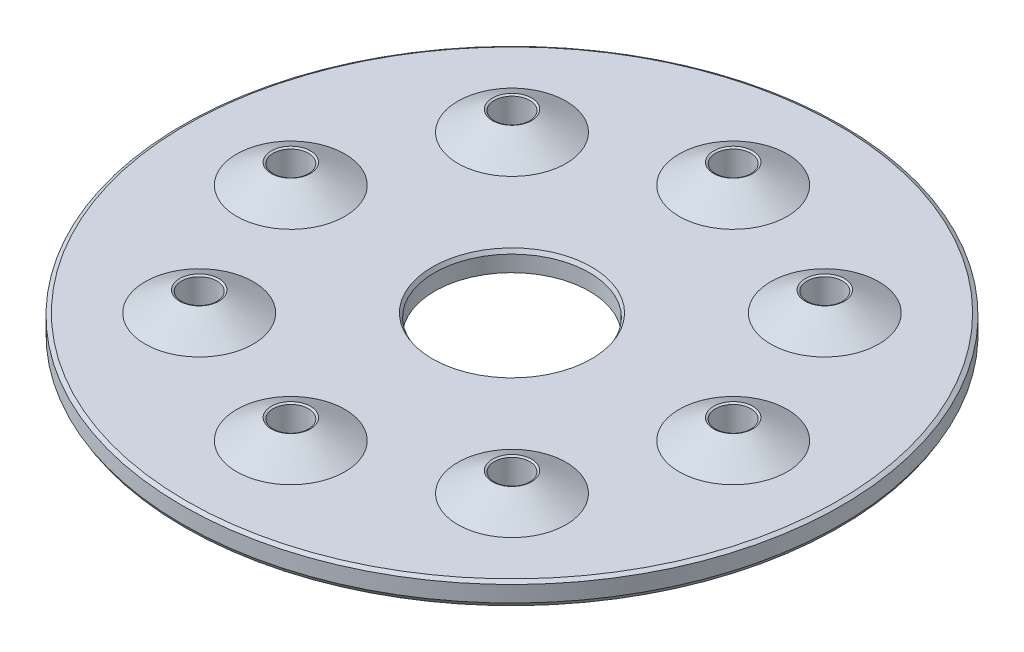
from build123d import *
from OCP.BRepFilletAPI import BRepFilletAPI_MakeChamfer

# Parameters (mm, degrees)
SKETCH1_R           = 74.5
SKETCH1_R_2         = 4
SKETCH1_R_3         = 17.5
BOSS_EXTRUDE1_DEPTH = 2.5
CHAMFER1_SIZE       = 0.5
CHAMFER1_SIZE2      = 0.866025404


# Read off the part's stored shape, not the designer's step: CirPattern1
with BuildPart() as part:
    # Sketch1 → Boss-Extrude1 (new, symmetric)
    with BuildSketch(Plane(origin=(0, 0, 0), x_dir=(1, 0, 0), z_dir=(0, 1, 0))):
        with Locations(Location((0, 0, 0), (0, 0, 270))):
            Circle(SKETCH1_R)
        with Locations(Location((0, 50, 0), (0, 0, 270))):
            Circle(SKETCH1_R_2, mode=Mode.SUBTRACT)
        with Locations(Location((35.355339059, 35.355339059, 0), (0, 0, 270))):
            Circle(SKETCH1_R_2, mode=Mode.SUBTRACT)
        with Locations(Location((50, 0, 0), (0, 0, 270))):
            Circle(SKETCH1_R_2, mode=Mode.SUBTRACT)
        with Locations(Location((35.355339059, -35.355339059, 0), (0, 0, 270))):
            Circle(SKETCH1_R_2, mode=Mode.SUBTRACT)
        with Locations(Location((0, -50, 0), (0, 0, 270))):
            Circle(SKETCH1_R_2, mode=Mode.SUBTRACT)
        with Locations(Location((-35.355339059, -35.355339059, 0), (0, 0, 270))):
            Circle(SKETCH1_R_2, mode=Mode.SUBTRACT)
        with Locations(Location((-50, 0, 0), (0, 0, 270))):
            Circle(SKETCH1_R_2, mode=Mode.SUBTRACT)
        with Locations(Location((-35.355339059, 35.355339059, 0), (0, 0, 270))):
            Circle(SKETCH1_R_2, mode=Mode.SUBTRACT)
        with Locations(Location((0, 0, 0), (0, 0, 270))):
            Circle(SKETCH1_R_3, mode=Mode.SUBTRACT)
    extrude(amount=BOSS_EXTRUDE1_DEPTH, both=True)

    # Sketch2 → Revolve1 (revolve)
    with BuildSketch(Plane(origin=(0, 0, 0), x_dir=(0, 0, -1), z_dir=(1, 0, 0)), mode=Mode.PRIVATE) as revolve1_sk:
        Polygon((-62.227241336, 2.5), (-54, 7.25), (-54, -7.25), (-62.227241336, -2.5), align=None)
    revolve(revolve1_sk.sketch.rotate(Axis((0, 2.5, 50), (0, 1, 0)), 180), axis=Axis((0, 2.5, 50), (0, 1, 0)))

    # Chamfer1: one chamfer whose edges measure the first distance from different faces: ONE call of the kernel's chamfer builder (chamfer() names one face for all edges)
    chamfer1_edges_1 = [part.edges().sort_by_distance(p)[0] for p in [
        (0, -2.5, -17.5),
    ]]
    chamfer1_side_1 = [part.faces().sort_by_distance(p)[0] for p in [
        (0, 0, -17.5),
    ]]
    chamfer1_edges_2 = [part.edges().sort_by_distance(p)[0] for p in [
        (0, 2.5, -17.5),
    ]]
    chamfer1_side_2 = [part.faces().sort_by_distance(p)[0] for p in [
        (0, 2.5, -72.392821792),
    ]]
    chamfer1_edges_3 = [part.edges().sort_by_distance(p)[0] for p in [
        (0, -2.5, -74.5),
    ]]
    chamfer1_side_3 = [part.faces().sort_by_distance(p)[0] for p in [
        (0, -2.5, -72.392821792),
    ]]
    chamfer1_edges_4 = [part.edges().sort_by_distance(p)[0] for p in [
        (0, -7.25, 54),
        (0, 7.25, 54),
    ]]
    chamfer1_edges_5 = [part.edges().sort_by_distance(p)[0] for p in [
        (0, 2.5, -74.5),
    ]]
    chamfer1_side_5 = [part.faces().sort_by_distance(p)[0] for p in [
        (0, 0, -74.5),
    ]]
    chamfer1 = BRepFilletAPI_MakeChamfer(part.part.solid().wrapped)
    for e in chamfer1_edges_1:
        chamfer1.Add(CHAMFER1_SIZE, CHAMFER1_SIZE2, e.wrapped, chamfer1_side_1[0].wrapped)  # the first distance lies on this face
    for e in chamfer1_edges_2:
        chamfer1.Add(CHAMFER1_SIZE, CHAMFER1_SIZE2, e.wrapped, chamfer1_side_2[0].wrapped)  # the first distance lies on this face
    for e in chamfer1_edges_3:
        chamfer1.Add(CHAMFER1_SIZE, CHAMFER1_SIZE2, e.wrapped, chamfer1_side_3[0].wrapped)  # the first distance lies on this face
    for e in chamfer1_edges_4:
        chamfer1.Add(CHAMFER1_SIZE, e.wrapped)
    for e in chamfer1_edges_5:
        chamfer1.Add(CHAMFER1_SIZE, CHAMFER1_SIZE2, e.wrapped, chamfer1_side_5[0].wrapped)  # the first distance lies on this face
    add(Compound.cast(chamfer1.Shape()), mode=Mode.REPLACE)

    # CirPattern1 outline → CirPattern1 (revolve)
    with BuildSketch(Plane(origin=(-35.355339059, 0, 35.355339059), x_dir=(1, 0, 0), z_dir=(0, 0, 1))):
        Polygon((4, -6.75), (4.433012702, -7), (12.227241336, -2.5), (4, -2.5), align=None)
        Polygon((4, 2.5), (12.227241336, 2.5), (4.433012702, 7), (4, 6.75), align=None)
    revolve(axis=Axis((-35.355339059, 0, 35.355339059), (0, 1, 0)))

    # CirPattern1 2 outline → CirPattern1 2 (revolve)
    with BuildSketch(Plane(origin=(-50, 0, 0), x_dir=(1, 0, 0), z_dir=(0, 0, 1))):
        Polygon((4, -6.75), (4.433012702, -7), (12.227241336, -2.5), (4, -2.5), align=None)
        Polygon((4, 2.5), (12.227241336, 2.5), (4.433012702, 7), (4, 6.75), align=None)
    revolve(axis=Axis((-50, 0, 0), (0, 1, 0)))

    # CirPattern1 3 outline → CirPattern1 3 (revolve)
    with BuildSketch(Plane(origin=(-35.355339059, 0, -35.355339059), x_dir=(1, 0, 0), z_dir=(0, 0, 1))):
        Polygon((4, -6.75), (4.433012702, -7), (12.227241336, -2.5), (4, -2.5), align=None)
        Polygon((4, 2.5), (12.227241336, 2.5), (4.433012702, 7), (4, 6.75), align=None)
    revolve(axis=Axis((-35.355339059, 0, -35.355339059), (0, 1, 0)))

    # CirPattern1 4 outline → CirPattern1 4 (revolve)
    with BuildSketch(Plane.XY.offset(-50)):
        Polygon((4, -6.75), (4.433012702, -7), (12.227241336, -2.5), (4, -2.5), align=None)
        Polygon((4, 2.5), (12.227241336, 2.5), (4.433012702, 7), (4, 6.75), align=None)
    revolve(axis=Axis((0, 0, -50), (0, 1, 0)))

    # CirPattern1 5 outline → CirPattern1 5 (revolve)
    with BuildSketch(Plane(origin=(35.355339059, 0, -35.355339059), x_dir=(1, 0, 0), z_dir=(0, 0, 1))):
        Polygon((4, -6.75), (4.433012702, -7), (12.227241336, -2.5), (4, -2.5), align=None)
        Polygon((4, 2.5), (12.227241336, 2.5), (4.433012702, 7), (4, 6.75), align=None)
    revolve(axis=Axis((35.355339059, 0, -35.355339059), (0, 1, 0)))

    # CirPattern1 6 outline → CirPattern1 6 (revolve)
    with BuildSketch(Plane(origin=(50, 0, 0), x_dir=(1, 0, 0), z_dir=(0, 0, 1))):
        Polygon((4, -6.75), (4.433012702, -7), (12.227241336, -2.5), (4, -2.5), align=None)
        Polygon((4, 2.5), (12.227241336, 2.5), (4.433012702, 7), (4, 6.75), align=None)
    revolve(axis=Axis((50, 0, 0), (0, 1, 0)))

    # CirPattern1 7 outline → CirPattern1 7 (revolve)
    with BuildSketch(Plane(origin=(35.355339059, 0, 35.355339059), x_dir=(1, 0, 0), z_dir=(0, 0, 1))):
        Polygon((4, -6.75), (4.433012702, -7), (12.227241336, -2.5), (4, -2.5), align=None)
        Polygon((4, 2.5), (12.227241336, 2.5), (4.433012702, 7), (4, 6.75), align=None)
    revolve(axis=Axis((35.355339059, 0, 35.355339059), (0, 1, 0)))


solid = part.part
